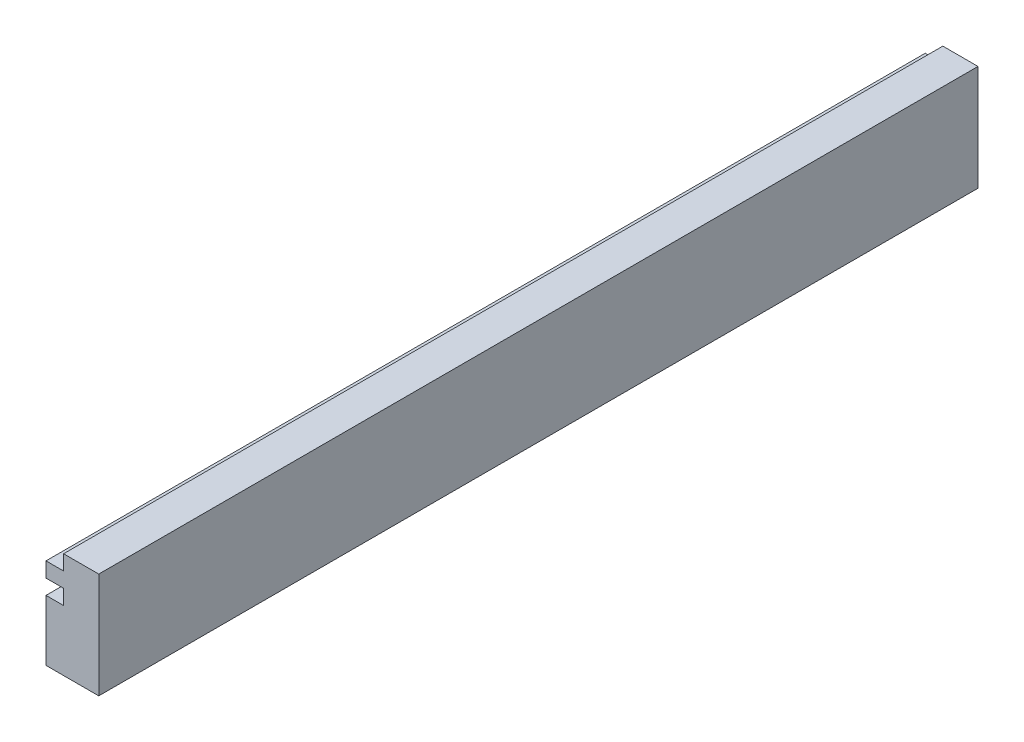
from build123d import *

# Parameters (mm, degrees)
SKETCH1_W           = 30
SKETCH1_H           = 60
BOSS_EXTRUDE1_DEPTH = 500
SKETCH2_W           = 10
SKETCH2_H           = 8.5
CUT_EXTRUDE1_DEPTH  = 500
SKETCH3_W           = 10
SKETCH3_H           = 8.5
CUT_EXTRUDE2_DEPTH  = 42.89


with BuildPart() as part:
    # Sketch1 → Boss-Extrude1 (new body)
    with BuildSketch(Plane.XY):
        with Locations((15, 30)):
            Rectangle(SKETCH1_W, SKETCH1_H)
    extrude(amount=BOSS_EXTRUDE1_DEPTH)

    # Sketch2 → Cut-Extrude1 (cut)
    with BuildSketch(Plane.XY.offset(500)):
        with Locations((5, 38.75)):
            Rectangle(SKETCH2_W, SKETCH2_H)
        with Locations((5, 55.75)):
            Rectangle(SKETCH2_W, SKETCH2_H)
    extrude(amount=-CUT_EXTRUDE1_DEPTH, mode=Mode.SUBTRACT)

    # Sketch3 → Cut-Extrude2 (cut)
    with BuildSketch(Plane(origin=(0, 0, 0), x_dir=(-1, 0, 0), z_dir=(0, 0, -1))):
        with Locations((-5, 21.75)):
            Rectangle(SKETCH3_W, SKETCH3_H)
    extrude(amount=-CUT_EXTRUDE2_DEPTH, mode=Mode.SUBTRACT)


solid = part.part
